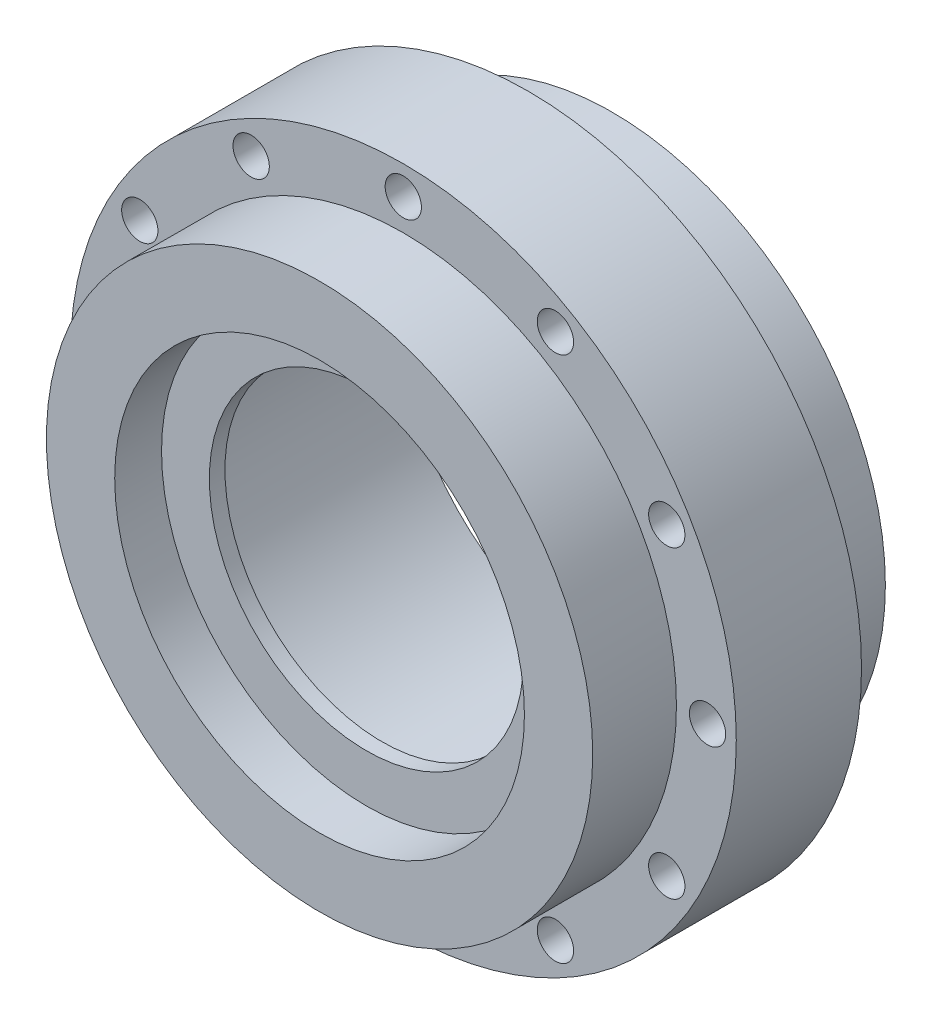
from build123d import *

# Parameters (mm, degrees)
SKETCH2_R                  = 4
CUT_EXTRUDE1_DEPTH         = 10
M8X1_25_TAPPED_HOLE2_D     = 6.8
M8X1_25_TAPPED_HOLE2_DEPTH = 19.75
M8X1_25_TAPPED_HOLE2_TIP   = 2.042926105
SKETCH7_W                  = 32.09110021
SKETCH7_H                  = 15.334740526
SKETCH8_R                  = 4.652226046
CUT_EXTRUDE2_DEPTH         = 133.027125309


with BuildPart() as part:
    # Sketch1 → Revolve1 (revolve)
    with BuildSketch(Plane(origin=(0, 0, 0), x_dir=(0, 0, -1), z_dir=(1, 0, 0))):
        Polygon((-84.79575879, 52.5), (-72.79575879, 52.5), (-72.79575879, 40.25), (-68.79575879, 40.25), (-68.79575879, 55), (-9.79575879, 55), (-9.79575879, 70), (-84.79575879, 70), align=None)
    revolve(axis=Axis((0, 0, 163.822734484), (0, 0, -1)))

    # Sketch2 → Cut-Extrude1 (cut)
    with BuildSketch(Plane(origin=(0, 0, 9.79575879), x_dir=(-1, 0, 0), z_dir=(0, 0, -1))):
        with Locations((0, 62.5)):
            Circle(SKETCH2_R)
        with Locations((0, -62.5)):
            Circle(SKETCH2_R)
    extrude(amount=-CUT_EXTRUDE1_DEPTH, mode=Mode.SUBTRACT)

    # M8x1.25 Tapped Hole2
    with Locations(Plane(origin=(0, 0, 0), x_dir=(1, 0, 0), z_dir=(0, 0, -1))):
        with Locations((-54.126587737, -31.25), (-31.25, -54.126587737), (-62.5, 0), (31.25, -54.126587737), (62.5, 0), (54.126587737, 31.25), (31.25, 54.126587737), (-31.25, 54.126587737), (-54.126587737, 31.25)):
            Hole(M8X1_25_TAPPED_HOLE2_D / 2, depth=M8X1_25_TAPPED_HOLE2_DEPTH)
            with Locations((0, 0, -(M8X1_25_TAPPED_HOLE2_DEPTH + M8X1_25_TAPPED_HOLE2_TIP / 2))):  # 118° drill point
                Cone(0, M8X1_25_TAPPED_HOLE2_D / 2, M8X1_25_TAPPED_HOLE2_TIP, mode=Mode.SUBTRACT)

    # Sketch7 → Revolve2 (revolve)
    with BuildSketch(Plane(origin=(0, 0, 0), x_dir=(0, 0, -1), z_dir=(1, 0, 0))):
        with Locations((-47.29575879, 77.667370263)):
            Rectangle(SKETCH7_W, SKETCH7_H)
    revolve(axis=Axis((0, 0, 163.822734484), (0, 0, -1)))

    # Sketch8 → Cut-Extrude2 (cut, through all)
    with BuildSketch(Plane(origin=(0, 0, 31.250208685), x_dir=(-1, 0, 0), z_dir=(0, 0, -1))):
        with Locations((0, 77.969134613)):
            Circle(SKETCH8_R)
        with Locations((38.984567307, 67.523251286)):
            Circle(SKETCH8_R)
        with Locations((67.523251286, 38.984567307)):
            Circle(SKETCH8_R)
        with Locations((77.969134613, 0)):
            Circle(SKETCH8_R)
        with Locations((67.523251286, -38.984567307)):
            Circle(SKETCH8_R)
        with Locations((38.984567307, -67.523251286)):
            Circle(SKETCH8_R)
        with Locations((0, -77.969134613)):
            Circle(SKETCH8_R)
        with Locations((-38.984567307, -67.523251286)):
            Circle(SKETCH8_R)
        with Locations((-67.523251286, -38.984567307)):
            Circle(SKETCH8_R)
        with Locations((-77.969134613, 0)):
            Circle(SKETCH8_R)
        with Locations((-67.523251286, 38.984567307)):
            Circle(SKETCH8_R)
        with Locations((-38.984567307, 67.523251286)):
            Circle(SKETCH8_R)
    extrude(amount=-CUT_EXTRUDE2_DEPTH, mode=Mode.SUBTRACT)


solid = part.part
